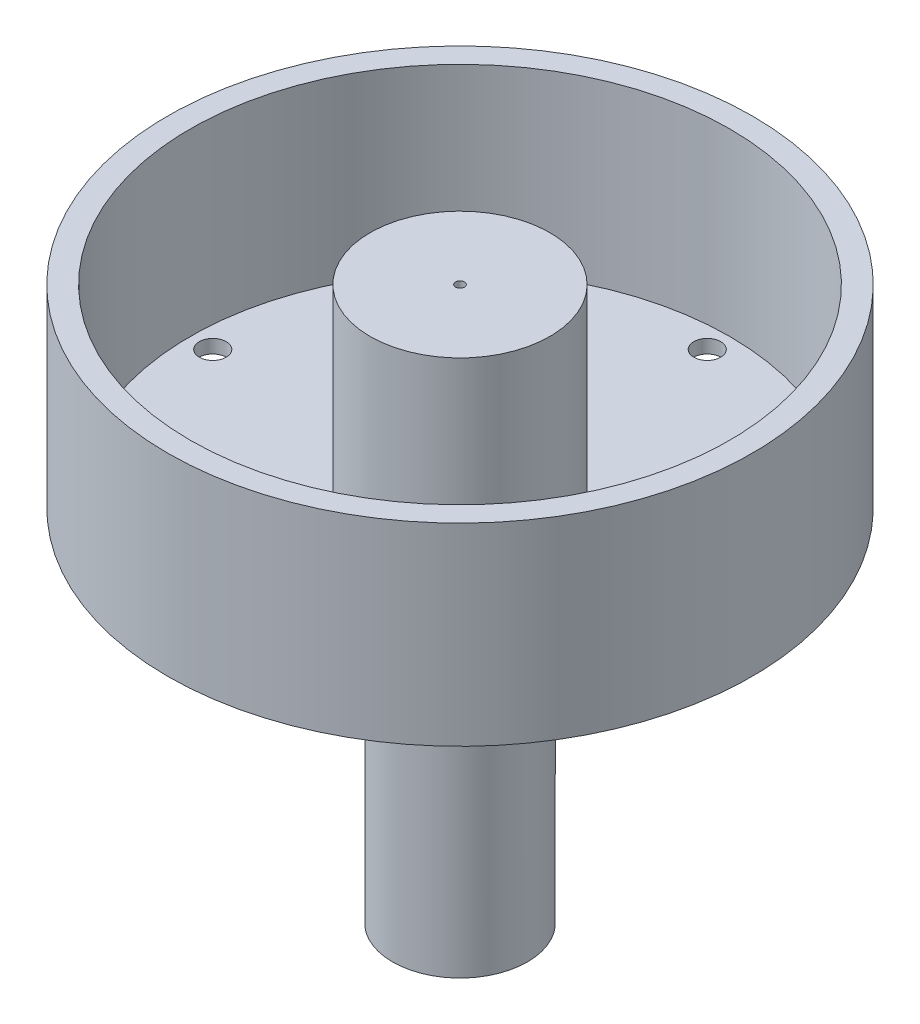
from build123d import *

# Parameters (mm, degrees)
SKETCH1_R           = 65
BOSS_EXTRUDE1_DEPTH = 3
SKETCH2_R           = 3
CUT_EXTRUDE1_DEPTH  = 92.972822073
CIRPATTERN1_COUNT   = 4
SKETCH3_R           = 65
SKETCH3_R_2         = 60
BOSS_EXTRUDE2_DEPTH = 40
SKETCH4_R           = 20
BOSS_EXTRUDE3_DEPTH = 40
SKETCH5_R           = 10
CUT_EXTRUDE2_DEPTH  = 30
SKETCH6_R           = 1
CUT_EXTRUDE3_DEPTH  = 102.483988885
EXTRUDE_START       = 80
SKETCH_1_R          = 15
SKETCH_1_R_2        = 10
EXTRUDE_1_DEPTH     = 80


with BuildPart() as part:
    # Sketch1 → Boss-Extrude1 (new body)
    with BuildSketch(Plane(origin=(0, 0, 0), x_dir=(1, 0, 0), z_dir=(0, 1, 0))):
        Circle(SKETCH1_R)
    extrude(amount=BOSS_EXTRUDE1_DEPTH)

    # Sketch2 → Cut-Extrude1 (cut, through all)
    with BuildSketch(Plane(origin=(0, 3, 0), x_dir=(1, 0, 0), z_dir=(0, 1, 0))):
        with Locations((0, 55)):
            Circle(SKETCH2_R)
    cut_extrude1 = extrude(amount=-CUT_EXTRUDE1_DEPTH, mode=Mode.SUBTRACT)

    # CirPattern1: Cut-Extrude1 ×4 about axis
    cirpattern1_axis = Axis((0, 3, 0), (0, 1, 0))
    for i in range(1, CIRPATTERN1_COUNT):
        add(cut_extrude1.rotate(cirpattern1_axis, i * 360 / CIRPATTERN1_COUNT), mode=Mode.SUBTRACT)

    # Sketch3 → Boss-Extrude2 (add)
    with BuildSketch(Plane(origin=(0, 3, 0), x_dir=(1, 0, 0), z_dir=(0, 1, 0))):
        Circle(SKETCH3_R)
        Circle(SKETCH3_R_2, mode=Mode.SUBTRACT)
    extrude(amount=BOSS_EXTRUDE2_DEPTH)

    # Sketch4 → Boss-Extrude3 (add)
    with BuildSketch(Plane(origin=(0, 3, 0), x_dir=(1, 0, 0), z_dir=(0, 1, 0))):
        Circle(SKETCH4_R)
    extrude(amount=BOSS_EXTRUDE3_DEPTH)

    # Sketch5 → Cut-Extrude2 (cut)
    with BuildSketch(Plane.XZ):
        Circle(SKETCH5_R)
    extrude(amount=-CUT_EXTRUDE2_DEPTH, mode=Mode.SUBTRACT)

    # Sketch6 → Cut-Extrude3 (cut, through all)
    with BuildSketch(Plane(origin=(0, 43, 0), x_dir=(1, 0, 0), z_dir=(0, 1, 0))):
        Circle(SKETCH6_R)
    extrude(amount=-CUT_EXTRUDE3_DEPTH, mode=Mode.SUBTRACT)

    # 草圖1 → 填料-伸長1 (add)
    with BuildSketch(Plane.XZ.offset(EXTRUDE_START)):
        Circle(SKETCH_1_R)
        Circle(SKETCH_1_R_2, mode=Mode.SUBTRACT)
    extrude(amount=-EXTRUDE_1_DEPTH)


solid = part.part
